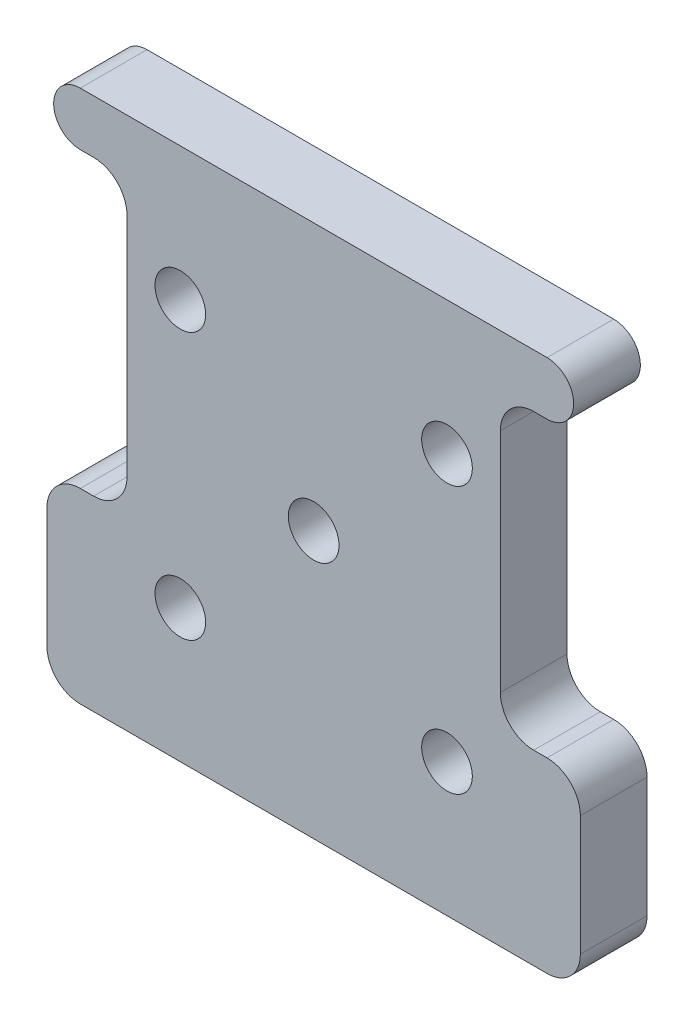
from build123d import *

# Parameters (mm, degrees)
SKETCH1_R           = 2.413
BOSS_EXTRUDE1_DEPTH = 6.35
FILLET1_R           = 3.175
FILLET3_R           = 2.54


with BuildPart() as part:
    # Sketch1 → Boss-Extrude1 (new body)
    with BuildSketch(Plane.XY):
        Polygon((-25.4, 0), (25.4, 0), (25.4, 17.78), (17.78, 17.78), (17.78, 45.72), (25.4, 45.72), (25.4, 50.8), (-25.4, 50.8), (-25.4, 45.72), (-17.78, 45.72), (-17.78, 17.78), (-25.4, 17.78), align=None)
        with Locations((-12.7, 12.7)):
            Circle(SKETCH1_R, mode=Mode.SUBTRACT)
        with Locations((12.7, 12.7)):
            Circle(SKETCH1_R, mode=Mode.SUBTRACT)
        with Locations((0, 25.4)):
            Circle(SKETCH1_R, mode=Mode.SUBTRACT)
        with Locations((-12.7, 38.1)):
            Circle(SKETCH1_R, mode=Mode.SUBTRACT)
        with Locations((12.7, 38.1)):
            Circle(SKETCH1_R, mode=Mode.SUBTRACT)
    extrude(amount=BOSS_EXTRUDE1_DEPTH)

    # Fillet1
    # the kernel refuses this fillet: 3.175 mm, written as the material it adds along each edge
    with BuildSketch(Plane(origin=(-17.78, 17.78, 0), x_dir=(0, 1, 0), z_dir=(0, 0, 1)), Plane(origin=(-17.78, 45.72, 0), x_dir=(-1, 0, 0), z_dir=(0, 0, 1)), Plane(origin=(17.78, 45.72, 0), x_dir=(0, -1, 0), z_dir=(0, 0, 1)), Plane(origin=(17.78, 17.78, 0), x_dir=(1, 0, 0), z_dir=(0, 0, 1))) as fillet1_piece_1:
        with BuildLine():
            CenterArc((FILLET1_R, FILLET1_R), FILLET1_R, 180, 90)
            Line((0, FILLET1_R), (0, 0))
            Line((0, 0), (FILLET1_R, 0))
        make_face()
    extrude(amount=6.35)
    # the kernel refuses this fillet: 3.175 mm, written as the material it takes off along each edge
    with BuildSketch(Plane(origin=(25.4, 0, -7.9375), x_dir=(-1, 0, 0), z_dir=(0, 0, 1)), Plane(origin=(-25.4, 45.72, -7.9375), x_dir=(0, 1, 0), z_dir=(0, 0, 1)), Plane(origin=(-25.4, 50.8, -7.9375), x_dir=(1, 0, 0), z_dir=(0, 0, 1)), Plane(origin=(25.4, 50.8, -7.9375), x_dir=(0, -1, 0), z_dir=(0, 0, 1)), Plane(origin=(25.4, 45.72, -7.9375), x_dir=(-1, 0, 0), z_dir=(0, 0, 1)), Plane(origin=(25.4, 17.78, -7.9375), x_dir=(0, -1, 0), z_dir=(0, 0, 1))) as fillet1_2_piece_1:
        with BuildLine():
            CenterArc((FILLET1_R, -FILLET1_R), FILLET1_R, 90, 90)
            Line((0, -FILLET1_R), (0, 0))
            Line((0, 0), (FILLET1_R, 0))
        make_face()
    extrude(amount=22.225, mode=Mode.SUBTRACT)
    with BuildSketch(Plane(origin=(-25.4, 0, -7.9375), x_dir=(1, 0, 0), z_dir=(0, 0, 1)), Plane(origin=(-25.4, 17.78, -7.9375), x_dir=(0, -1, 0), z_dir=(0, 0, 1))) as fillet1_2_piece_2:
        with BuildLine():
            CenterArc((FILLET1_R, FILLET1_R), FILLET1_R, 180, 90)
            Line((0, FILLET1_R), (0, 0))
            Line((0, 0), (FILLET1_R, 0))
        make_face()
    extrude(amount=22.225, mode=Mode.SUBTRACT)

    # Fillet3
    # the kernel refuses this fillet: 2.54 mm, written as the material it takes off along each edge
    with BuildSketch(Plane(origin=(-25.335851973, 48.26, 16.390208023), x_dir=(0.774595457226018, 0.6324570164404979, 0), z_dir=(0, 0, -1))) as fillet3_piece_1:
        with BuildLine():
            CenterArc((2.409649921, 1.967478618), FILLET3_R, 129.231849882, 179.999560802)
            ThreePointArc((0.803201559, 3.934944923), (-0.299592395, 2.110600119), (0, 0))
            ThreePointArc((0, 0), (2.008041601, -0.715651727), (4.016083202, 0))
        make_face()
    extrude(amount=26.430416045, mode=Mode.SUBTRACT)
    with BuildSketch(Plane(origin=(25.335851973, 48.26, 16.390208022), x_dir=(-0.774595458044749, -0.632457015437765, 0), z_dir=(0, 0, -1))) as fillet3_piece_2:
        with BuildLine():
            CenterArc((2.409649925, 1.967478616), FILLET3_R, 129.23184966, 179.999561099)
            ThreePointArc((0.80320157, 3.934944927), (-0.299592391, 2.110600124), (0, 0))
            ThreePointArc((0, 0), (2.008041604, -0.71565173), (4.016083209, 0))
        make_face()
    extrude(amount=26.430416044, mode=Mode.SUBTRACT)


solid = part.part
